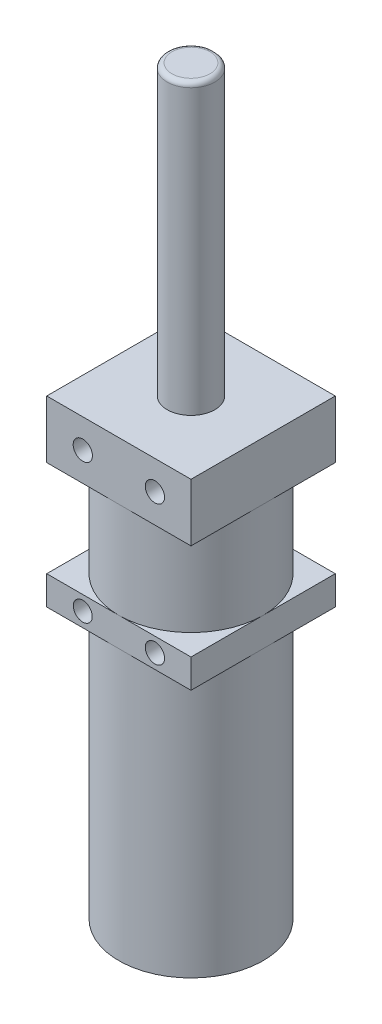
from build123d import *

# Parameters (mm, degrees)
SKETCH1_W           = 38.1
SKETCH1_H           = 38.1
BOSS_EXTRUDE1_DEPTH = 7.62
SKETCH2_R           = 19.05
BOSS_EXTRUDE2_DEPTH = 25.4
SKETCH3_W           = 38.1
SKETCH3_H           = 38.1
BOSS_EXTRUDE3_DEPTH = 15.24
SKETCH4_R           = 6.296459426
BOSS_EXTRUDE4_DEPTH = 76.2
SKETCH5_W           = 3.175
SKETCH5_H           = 1.58699954
CUT_EXTRUDE1_DEPTH  = 73.66
SKETCH6_R           = 2.54
SKETCH6_R_2         = 2.5
CUT_EXTRUDE2_DEPTH  = 7.62
BOSS_EXTRUDE5_START = 71.374
SKETCH7_R           = 19.05
BOSS_EXTRUDE5_DEPTH = 71.374


with BuildPart() as part:
    # Sketch1 → Boss-Extrude1 (new body)
    with BuildSketch(Plane(origin=(0, 0, 0), x_dir=(1, 0, 0), z_dir=(0, 1, 0))):
        Rectangle(SKETCH1_W, SKETCH1_H)
    extrude(amount=BOSS_EXTRUDE1_DEPTH)

    # Sketch2 → Boss-Extrude2 (add)
    with BuildSketch(Plane(origin=(0, 7.62, 0), x_dir=(1, 0, 0), z_dir=(0, 1, 0))):
        with Locations(Location((0, 0, 0), (0, 0, 270))):
            Circle(SKETCH2_R)
    extrude(amount=BOSS_EXTRUDE2_DEPTH)

    # Sketch3 → Boss-Extrude3 (add)
    with BuildSketch(Plane(origin=(0, 33.02, 0), x_dir=(1, 0, 0), z_dir=(0, 1, 0))):
        Rectangle(SKETCH3_W, SKETCH3_H)
    extrude(amount=BOSS_EXTRUDE3_DEPTH)

    # Sketch4 → Boss-Extrude4 (add)
    with BuildSketch(Plane(origin=(0, 48.26, 0), x_dir=(1, 0, 0), z_dir=(0, 1, 0))):
        with Locations(Location((0, 0, 0), (0, 0, 90))):
            Circle(SKETCH4_R)
    extrude(amount=BOSS_EXTRUDE4_DEPTH)

    # Sketch5 → Cut-Extrude1 (cut)
    with BuildSketch(Plane(origin=(0, 124.46, 0), x_dir=(1, 0, 0), z_dir=(0, 1, 0))):
        with Locations((0, 6.38149977)):
            Rectangle(SKETCH5_W, SKETCH5_H)
    extrude(amount=-CUT_EXTRUDE1_DEPTH, mode=Mode.SUBTRACT)

    # Fillet1: read off the stored shape, not the designer's step
    # Fillet1 outline → Fillet1 (revolve, cut)
    with BuildSketch(Plane.XY):
        with BuildLine():
            ThreePointArc((5.026459426, 124.46), (5.924485038, 124.088025612), (6.296459426, 123.19))
            Line((6.296459426, 123.19), (6.296459426, 124.46))
            Line((6.296459426, 124.46), (5.026459426, 124.46))
        make_face()
    revolve(axis=Axis((0, 0, 0), (0, 1, 0)), mode=Mode.SUBTRACT)

    # Sketch6 → Cut-Extrude2 (cut)
    with BuildSketch(Plane(origin=(0, 0, -19.05), x_dir=(-1, 0, 0), z_dir=(0, 0, -1))):
        with Locations((-9.525, 3.81)):
            Circle(SKETCH6_R)
        with Locations((-9.525, 40.64)):
            Circle(SKETCH6_R)
        with Locations((9.525, 40.64)):
            Circle(SKETCH6_R)
        with Locations((9.525, 3.81)):
            Circle(SKETCH6_R_2)
    cut_extrude2 = extrude(amount=-CUT_EXTRUDE2_DEPTH, mode=Mode.SUBTRACT)

    # Mirror1: Cut-Extrude2 across plane
    add(cut_extrude2.mirror(Plane.XY), mode=Mode.SUBTRACT)

    # Sketch7 → Boss-Extrude5 (add)
    with BuildSketch(Plane.XZ.offset(BOSS_EXTRUDE5_START)):
        with Locations(Location((0, 0, 0), (0, 0, 270))):
            Circle(SKETCH7_R)
    extrude(amount=-BOSS_EXTRUDE5_DEPTH)


solid = part.part
